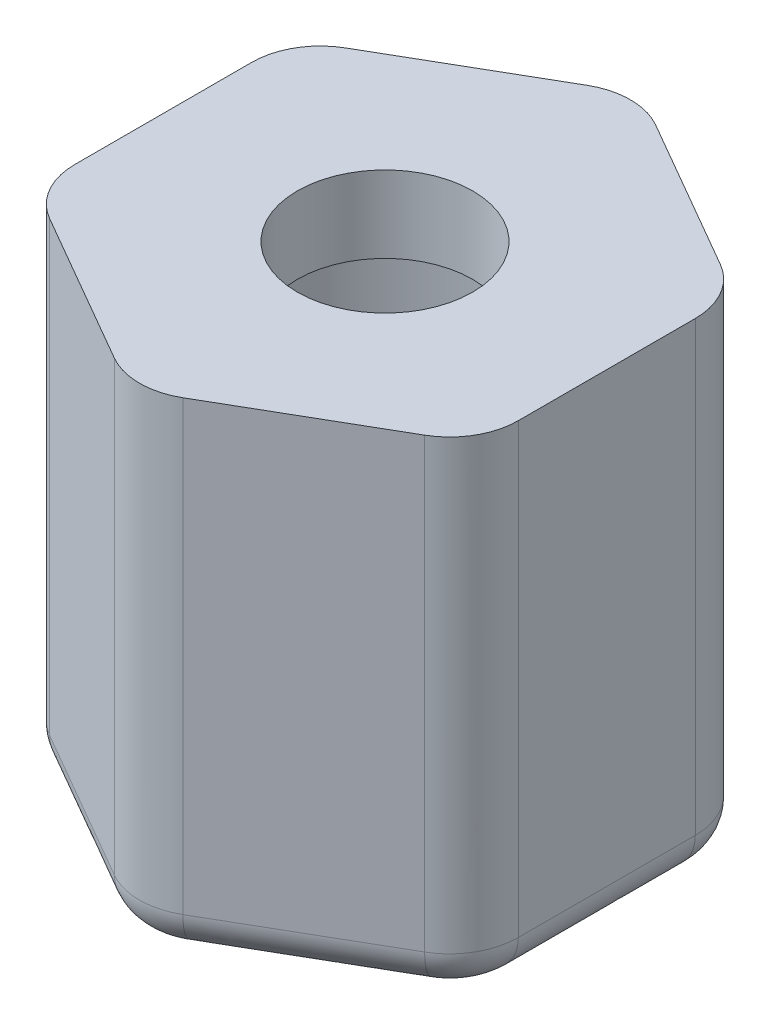
from build123d import *

# Parameters (mm, degrees)
BOSS_EXTRUDE1_DEPTH = 24.2
SKETCH3_R           = 8.85
CUT_EXTRUDE1_DEPTH  = 24.2
SKETCH4_R           = 4.35
BOSS_EXTRUDE2_DEPTH = 3.8
FILLET1_R           = 3.4
FILLET2_R           = 2


with BuildPart() as part:
    # Sketch1 → Boss-Extrude1 (new body)
    with BuildSketch(Plane(origin=(0, 0, 0), x_dir=(1, 0, 0), z_dir=(0, 1, 0))):
        Polygon((0, 12.701705922), (-11, 6.350852961), (-11, -6.350852961), (0, -12.701705922), (11, -6.350852961), (11, 6.350852961), align=None)
    extrude(amount=BOSS_EXTRUDE1_DEPTH)

    # Sketch3 → Cut-Extrude1 (cut)
    with BuildSketch(Plane(origin=(0, 24.2, 0), x_dir=(1, 0, 0), z_dir=(0, 1, 0))):
        Circle(SKETCH3_R)
    extrude(amount=-CUT_EXTRUDE1_DEPTH, mode=Mode.SUBTRACT)

    # Sketch4 → Boss-Extrude2 (add)
    with BuildSketch(Plane(origin=(0, 24.2, 0), x_dir=(1, 0, 0), z_dir=(0, 1, 0))):
        Polygon((-11, 6.350852961), (-11, -6.350852961), (0, -12.701705922), (11, -6.350852961), (11, 6.350852961), (0, 12.701705922), align=None)
        Circle(SKETCH4_R, mode=Mode.SUBTRACT)
    extrude(amount=-BOSS_EXTRUDE2_DEPTH)

    # Fillet1
    fillet1_edges = [part.edges().sort_by_distance(p)[0] for p in [
        (-11, 12.1, -6.350852961),
        (-11, 12.1, 6.350852961),
        (0, 12.1, 12.701705922),
        (11, 12.1, 6.350852961),
        (11, 12.1, -6.350852961),
        (0, 12.1, -12.701705922),
    ]]
    fillet(fillet1_edges, radius=FILLET1_R)

    # Fillet2
    fillet2_edges = [part.edges().sort_by_distance(p)[0] for p in [
        (-10.544486373, 0, -6.087862046),
        (-11, 0, 0),
        (-10.544486373, 0, 6.087862046),
        (-5.5, 0, 9.526279442),
        (0, 0, 12.175724092),
        (5.5, 0, 9.526279442),
        (10.544486373, 0, 6.087862046),
        (11, 0, 0),
        (10.544486373, 0, -6.087862046),
        (5.5, 0, -9.526279442),
        (0, 0, -12.175724092),
        (-5.5, 0, -9.526279442),
    ]]
    fillet(fillet2_edges, radius=FILLET2_R)


solid = part.part
